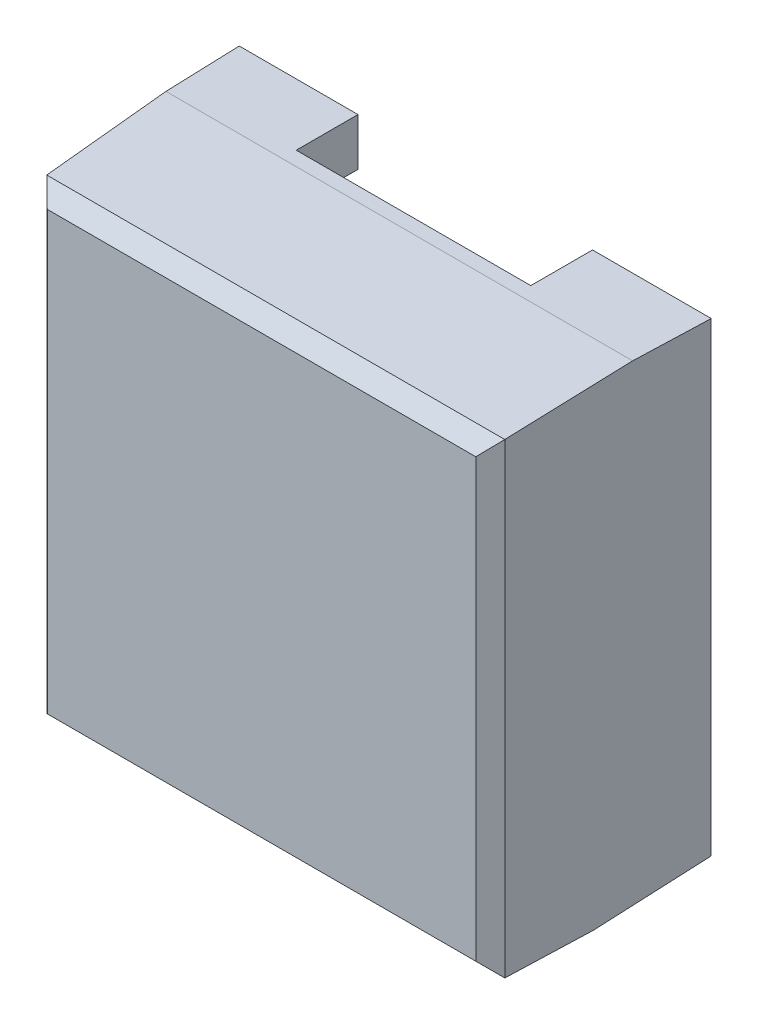
from build123d import *

# Parameters (mm, degrees)
SKETCH1_W           = 10
SKETCH1_H           = 10
BOSS_EXTRUDE1_DEPTH = 4.5
CHAMFER1_SIZE       = 2.9
CHAMFER1_SIZE2      = 0.2
CHAMFER3_SIZE       = 0.18787374
CHAMFER3_SIZE_2     = 5.38
CHAMFER4_SIZE       = 0.3
CUT_EXTRUDE1_DEPTH  = 1.3
CHAMFER5_SIZE       = 0.2
CHAMFER5_SIZE2      = 2.4


with BuildPart() as part:
    # Sketch1 → Boss-Extrude1 (new body)
    with BuildSketch(Plane.XY):
        with Locations((5, 5)):
            Rectangle(SKETCH1_W, SKETCH1_H)
    extrude(amount=BOSS_EXTRUDE1_DEPTH)

    # Chamfer1
    chamfer1_edges = [part.edges().sort_by_distance(p)[0] for p in [
        (5, 10, 4.5),
    ]]
    chamfer1_side = [part.faces().sort_by_distance(p)[0] for p in [
        (5, 10, 2.25),
    ]]
    chamfer(chamfer1_edges, length=CHAMFER1_SIZE, length2=CHAMFER1_SIZE2, reference=chamfer1_side[0])

    # Chamfer3
    # the kernel refuses this chamfer: 5.38, 0.18787374 mm, written as the material it takes off along each edge
    with BuildSketch(Plane(origin=(0, 23.787684867, 4.5), x_dir=(0.6724220033128364, 0, 0.7401679873250072), z_dir=(0, -1, 0))) as chamfer3_piece_1:
        Polygon((CHAMFER3_SIZE * 0.672422002832, -CHAMFER3_SIZE * 0.740167986796), (-CHAMFER3_SIZE_2 * 0.740167987325, -CHAMFER3_SIZE_2 * 0.672422003313), (0, 0), align=None)
    extrude(amount=37.775369733, mode=Mode.SUBTRACT)
    with BuildSketch(Plane(origin=(10, -13.987684867, 4.5), x_dir=(0.0013423185755924109, 0, -0.999999099090015), z_dir=(0, 1, 0))) as chamfer3_piece_2:
        Polygon((CHAMFER3_SIZE_2 * 0.99999909909, CHAMFER3_SIZE_2 * 0.00134231857559), (-CHAMFER3_SIZE * 0.00134231857463, CHAMFER3_SIZE * 0.999999098375), (0, 0), align=None)
    extrude(amount=37.775369733, mode=Mode.SUBTRACT)

    # Chamfer4
    chamfer4_edges = [part.edges().sort_by_distance(p)[0] for p in [
        (5, 9.8, 4.5),
        (5, 0, 4.5),
        (9.81212626, 4.9, 4.5),
        (0.18787374, 4.9, 4.5),
    ]]
    chamfer(chamfer4_edges, length=CHAMFER4_SIZE)

    # Sketch2 → Cut-Extrude1 (cut)
    with BuildSketch(Plane(origin=(0, 0, 0), x_dir=(-1, 0, 0), z_dir=(0, 0, -1))):
        Polygon((-7.469269723, 10), (-7.469269723, 9), (-7.969269723, 9), (-8.469269723, 4), (-1.530730277, 4), (-2.030730277, 9), (-2.530730277, 9), (-2.530730277, 10), align=None)
    extrude(amount=-CUT_EXTRUDE1_DEPTH, mode=Mode.SUBTRACT)

    # Chamfer5
    chamfer5_edges = [part.edges().sort_by_distance(p)[0] for p in [
        (5, 0, 0),
    ]]
    chamfer5_side = [part.faces().sort_by_distance(p)[0] for p in [
        (5, 3.900810123, 0),
    ]]
    chamfer(chamfer5_edges, length=CHAMFER5_SIZE, length2=CHAMFER5_SIZE2, reference=chamfer5_side[0])


solid = part.part
